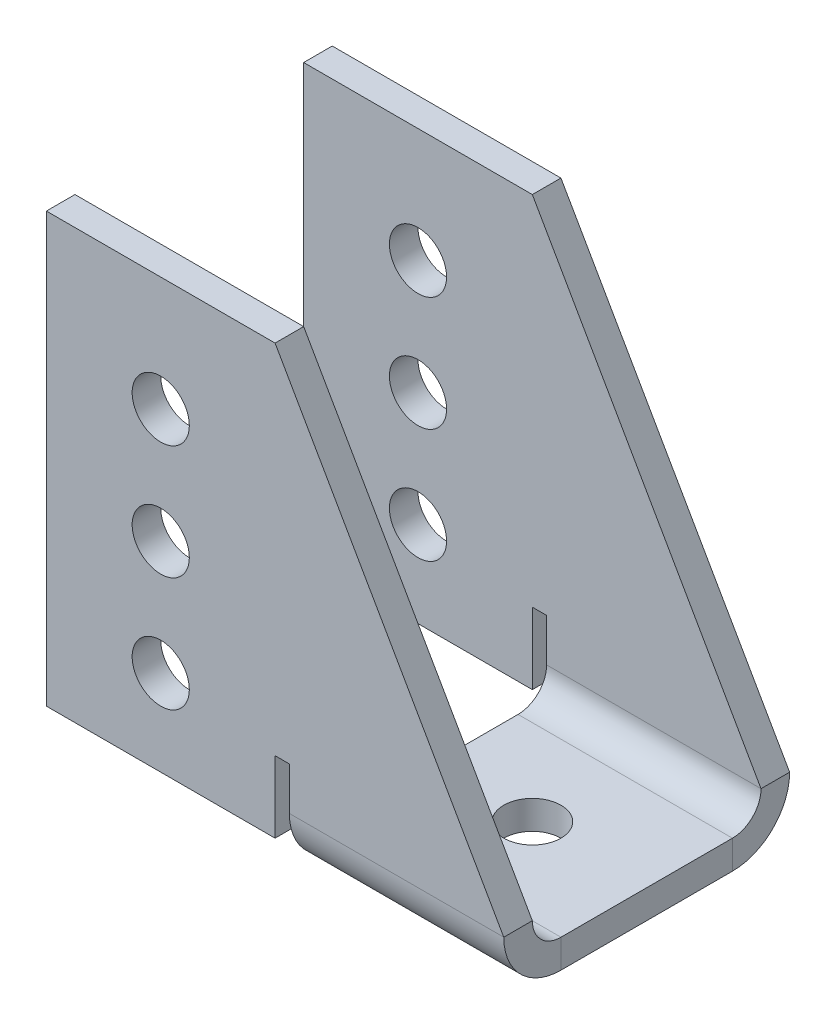
from build123d import *

# Parameters (mm, degrees)
BOSS_EXTRUDE1_START        = -0.486816485
BOSS_EXTRUDE1_DEPTH        = 3.661816485
SKETCH2_W                  = 23.8125
SKETCH2_H                  = 3.175
BOSS_EXTRUDE2_DEPTH        = 25.4
CUT_EXTRUDE1_DEPTH         = 79.943753108
CUT_EXTRUDE1_DEPTH_BACK    = 79.943753108
SKETCH3_R                  = 3.175
CUT_EXTRUDE2_DEPTH         = 76.643257039
CUT_EXTRUDE2_DEPTH_BACK    = 76.643257039
SKETCH6_R                  = 3.175
CUT_EXTRUDE3_DEPTH         = 79.943753108
CUT_EXTRUDE3_DEPTH_BACK    = 79.943753108
SKETCH7_W                  = 26.9875
SKETCH7_H                  = 3.175
FILLET1_R                  = 3.175
CONVERT_SOLID1_DEPTH       = 50.8
CONVERT_SOLID1_START       = 25.4
CONVERT_SOLID1_2_OUTLINE_W = 7.9375
CONVERT_SOLID1_2_OUTLINE_H = 3.175
CONVERT_SOLID1_2_DEPTH     = 1.5875
CONVERT_SOLID1_START_2     = 26.9875
CONVERT_SOLID1_3_DEPTH     = 23.8125
CONVERT_SOLID1_4_DEPTH     = 23.8125


# Read off the part's stored shape, not the designer's step: Convert-Solid1
with BuildPart() as part:
    # Sketch1 → Boss-Extrude1 (new body)
    with BuildSketch(Plane.XY.offset(BOSS_EXTRUDE1_START)):
        Polygon((50.8, 6.35), (25.4, 50.8), (0, 50.8), (0, 0), (50.8, 0), align=None)
    boss_extrude1 = extrude(amount=BOSS_EXTRUDE1_DEPTH)

    # Sketch2 → Boss-Extrude2 (add)
    with BuildSketch(Plane(origin=(0, 0, -0.486816485), x_dir=(-1, 0, 0), z_dir=(0, 0, -1))):
        with Locations((-38.89375, 1.5875)):
            Rectangle(SKETCH2_W, SKETCH2_H)
    extrude(amount=BOSS_EXTRUDE2_DEPTH)

    # Mirror1: Boss-Extrude1 across plane
    add(boss_extrude1.mirror(Plane(origin=(0, 0, -13.186816485), x_dir=(1, 0, 0), z_dir=(0, 0, -1))))

    # Sketch3 → Cut-Extrude1 (cut, two sides: drawn at the far end of the back side and taken through both)
    with BuildSketch(Plane.XY.offset(3.175).offset(-CUT_EXTRUDE1_DEPTH_BACK)):
        with Locations((12.7, 12.7)):
            Circle(SKETCH3_R)
        with Locations((12.7, 25.4)):
            Circle(SKETCH3_R)
        with Locations((12.7, 38.1)):
            Circle(SKETCH3_R)
    extrude(amount=CUT_EXTRUDE1_DEPTH + CUT_EXTRUDE1_DEPTH_BACK, mode=Mode.SUBTRACT)

    # Sketch6 → Cut-Extrude2 (cut, two sides: drawn at the far end of the back side and taken through both)
    with BuildSketch(Plane(origin=(0, 3.175, 0), x_dir=(1, 0, 0), z_dir=(0, 1, 0)).offset(-CUT_EXTRUDE2_DEPTH_BACK)):
        with Locations(Location((38.1, 13.186816485, 0), (0, 0, 270))):
            Circle(SKETCH6_R)
    extrude(amount=CUT_EXTRUDE2_DEPTH + CUT_EXTRUDE2_DEPTH_BACK, mode=Mode.SUBTRACT)

    # Sketch7 → Cut-Extrude3 (cut, two sides: drawn at the far end of the back side and taken through both)
    with BuildSketch(Plane(origin=(0, 0, -29.54863297), x_dir=(-1, 0, 0), z_dir=(0, 0, -1)).offset(-CUT_EXTRUDE3_DEPTH_BACK)):
        with Locations((-13.49375, 1.5875)):
            Rectangle(SKETCH7_W, SKETCH7_H)
    extrude(amount=CUT_EXTRUDE3_DEPTH + CUT_EXTRUDE3_DEPTH_BACK, mode=Mode.SUBTRACT)

    # Fillet1
    fillet1_edges = [part.edges().sort_by_distance(p)[0] for p in [
        (38.89375, 0, -29.54863297),
        (38.89375, 0, 3.175),
    ]]
    fillet(fillet1_edges, radius=FILLET1_R)

    # Convert-Solid1 outline → Convert-Solid1 (cut)
    with BuildSketch(Plane.YZ):
        with BuildLine():
            Line((50.8, -29.061816485), (3.175, -29.061816485))
            Line((3.175, -29.061816485), (3.175, -28.2110778))
            ThreePointArc((3.175, -28.2110778), (0.850738686, -25.886816486), (0, -22.711816485))
            Line((0, -22.711816485), (0, -26.37363297))
            ThreePointArc((0, -26.37363297), (0.92993597, -28.618697), (3.175, -29.54863297))
            Line((3.175, -29.54863297), (50.8, -29.54863297))
            Line((50.8, -29.54863297), (50.8, -29.061816485))
        make_face()
        with BuildLine():
            Line((0, 0), (0, -3.661816485))
            ThreePointArc((0, -3.661816485), (0.850738686, -0.486816484), (3.175, 1.83744483))
            Line((3.175, 1.83744483), (3.175, 2.688183515))
            Line((3.175, 2.688183515), (50.8, 2.688183515))
            Line((50.8, 2.688183515), (50.8, 3.175))
            Line((50.8, 3.175), (3.175, 3.175))
            ThreePointArc((3.175, 3.175), (0.92993597, 2.24506403), (0, 0))
        make_face()
    extrude(amount=CONVERT_SOLID1_DEPTH, mode=Mode.SUBTRACT)

    # Convert-Solid1 2 outline → Convert-Solid1 2 (cut)
    with BuildSketch(Plane.YZ.offset(CONVERT_SOLID1_START)):
        with Locations((7.14375, -27.474316485)):
            Rectangle(CONVERT_SOLID1_2_OUTLINE_W, CONVERT_SOLID1_2_OUTLINE_H)
        with Locations((7.14375, 1.100683515)):
            Rectangle(CONVERT_SOLID1_2_OUTLINE_W, CONVERT_SOLID1_2_OUTLINE_H)
    extrude(amount=CONVERT_SOLID1_2_DEPTH, mode=Mode.SUBTRACT)

    # Convert-Solid1 3 outline → Convert-Solid1 3 (cut)
    with BuildSketch(Plane.YZ.offset(CONVERT_SOLID1_START_2)):
        with BuildLine():
            Line((3.175, -29.061816485), (6.35, -29.061816485))
            ThreePointArc((6.35, -29.061816485), (4.706499064, -28.845445482), (3.175, -28.2110778))
            Line((3.175, -28.2110778), (3.175, -29.061816485))
        make_face()
        with BuildLine():
            Line((3.175, 2.688183515), (3.175, 1.83744483))
            ThreePointArc((3.175, 1.83744483), (4.706499064, 2.471812512), (6.35, 2.688183515))
            Line((6.35, 2.688183515), (3.175, 2.688183515))
        make_face()
    extrude(amount=CONVERT_SOLID1_3_DEPTH, mode=Mode.SUBTRACT)

    # Convert-Solid1 4 outline → Convert-Solid1 4 (add)
    with BuildSketch(Plane.YZ.offset(CONVERT_SOLID1_START_2)):
        with BuildLine():
            Line((3.175, -25.886816485), (6.35, -25.886816485))
            ThreePointArc((6.35, -25.886816485), (4.10493597, -24.956880515), (3.175, -22.711816485))
            Line((3.175, -22.711816485), (3.175, -25.886816485))
        make_face()
        with BuildLine():
            Line((3.175, -0.486816485), (3.175, -3.661816485))
            ThreePointArc((3.175, -3.661816485), (4.10493597, -1.416752455), (6.35, -0.486816485))
            Line((6.35, -0.486816485), (3.175, -0.486816485))
        make_face()
    extrude(amount=CONVERT_SOLID1_4_DEPTH)


solid = part.part
